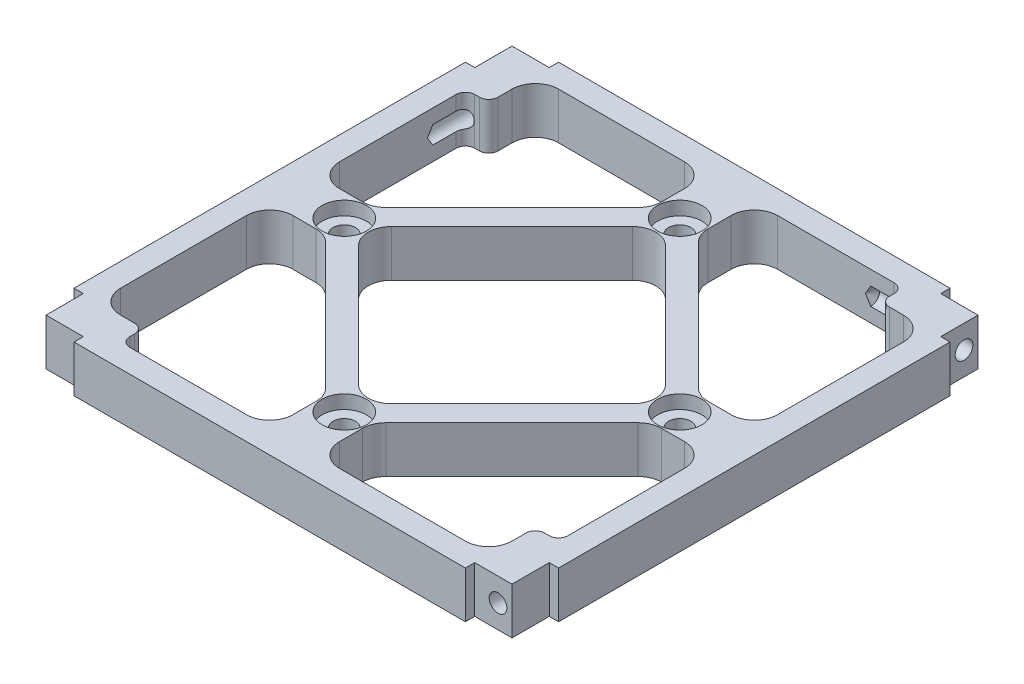
from build123d import *

# Parameters (mm, degrees)
SKETCH1_W                                           = 104
SKETCH1_H                                           = 104
BOSS_EXTRUDE1_DEPTH                                 = 10
FILLET1_R                                           = 5
CUT_EXTRUDE1_DEPTH                                  = 75.215901261
CIRPATTERN1_COUNT                                   = 4
CBORE_FOR_12_BINDING_HEAD_MACHINE_SCREW_D           = 4.8006
CBORE_FOR_12_BINDING_HEAD_MACHINE_SCREW_CBORE_D     = 9.525
CBORE_FOR_12_BINDING_HEAD_MACHINE_SCREW_CBORE_DEPTH = 2.921
FILLET3_R                                           = 2
CIRPATTERN5_COUNT                                   = 4


with BuildPart() as part:
    # Sketch1 → Boss-Extrude1 (new body)
    with BuildSketch(Plane(origin=(0, 0, 0), x_dir=(1, 0, 0), z_dir=(0, 1, 0))):
        Rectangle(SKETCH1_W, SKETCH1_H)
        Polygon((-42, 47), (-42, 37), (-47, 37), (-47, 5), (-35, 5), (-5, 35), (-5, 47), align=None, mode=Mode.SUBTRACT)
        Polygon((-32.928932188, 0), (0, 32.928932188), (32.928932188, 0), (0, -32.928932188), align=None, mode=Mode.SUBTRACT)
        Polygon((5, 47), (5, 35), (35, 5), (47, 5), (47, 42), (37, 42), (37, 47), align=None, mode=Mode.SUBTRACT)
        Polygon((47, -5), (35, -5), (5, -35), (5, -47), (42, -47), (42, -37), (47, -37), align=None, mode=Mode.SUBTRACT)
        Polygon((-5, -47), (-5, -35), (-35, -5), (-47, -5), (-47, -42), (-37, -42), (-37, -47), align=None, mode=Mode.SUBTRACT)
    extrude(amount=BOSS_EXTRUDE1_DEPTH)

    # Fillet1
    fillet1_edges = [part.edges().sort_by_distance(p)[0] for p in [
        (32.928932188, 5, 0),
        (0, 5, 32.928932188),
        (-32.928932188, 5, 0),
        (0, 5, -32.928932188),
        (-5, 5, -47),
        (-5, 5, -35),
        (-35, 5, -5),
        (-47, 5, 42),
        (-47, 5, 5),
        (-35, 5, 5),
        (-5, 5, 35),
        (-5, 5, 47),
        (42, 5, 47),
        (47, 5, 5),
        (35, 5, 5),
        (5, 5, 35),
        (5, 5, 47),
        (47, 5, -42),
        (47, 5, -5),
        (35, 5, -5),
        (5, 5, -35),
        (5, 5, -47),
        (-42, 5, -47),
        (-47, 5, -5),
    ]]
    fillet(fillet1_edges, radius=FILLET1_R)

    # Sketch2 → Cut-Extrude1 (cut, through all)
    with BuildSketch(Plane(origin=(0, 10, 0), x_dir=(1, 0, 0), z_dir=(0, 1, 0))):
        Polygon((-52, 52), (-42, 52), (-42, 50), (-50, 50), (-50, 42), (-52, 42), align=None)
    cut_extrude1 = extrude(amount=-CUT_EXTRUDE1_DEPTH, mode=Mode.SUBTRACT)

    # CirPattern1: Cut-Extrude1 ×4 about axis
    cirpattern1_axis = Axis((0, 10.5, 0), (0, -1, 0))
    for i in range(1, CIRPATTERN1_COUNT):
        add(cut_extrude1.rotate(cirpattern1_axis, i * 360 / CIRPATTERN1_COUNT), mode=Mode.SUBTRACT)

    # CBORE for #12 Binding Head Machine Screw1 (through all)
    with Locations(Plane(origin=(0, 10, 0), x_dir=(1, 0, 0), z_dir=(0, 1, 0))):
        with Locations((0, 36), (-36, 0), (0, -36), (36, 0)):
            CounterBoreHole(CBORE_FOR_12_BINDING_HEAD_MACHINE_SCREW_D / 2, CBORE_FOR_12_BINDING_HEAD_MACHINE_SCREW_CBORE_D / 2, CBORE_FOR_12_BINDING_HEAD_MACHINE_SCREW_CBORE_DEPTH)

    # Fillet3
    fillet3_edges = [part.edges().sort_by_distance(p)[0] for p in [
        (-37, 5, 42),
        (-37, 5, 47),
        (42, 5, 37),
        (47, 5, 37),
        (37, 5, -42),
        (37, 5, -47),
        (-47, 5, -37),
        (-42, 5, -37),
    ]]
    fillet(fillet3_edges, radius=FILLET3_R)

    # Sketch9 → #10-24 Tapped Hole1 (revolve, cut)
    with BuildSketch(Plane(origin=(50, 5, -47), x_dir=(0, 0, -1), z_dir=(0, 1, 0))):
        Polygon((0, 0), (0, 21.140824014), (1.89865, 20), (1.89865, 0), align=None)
    f_10_24_tapped_hole1 = revolve(axis=Axis((56.35, 5, -47), (-1, 0, 0)), mode=Mode.SUBTRACT)

    # CirPattern5: #10-24 Tapped Hole1 ×4 about axis
    cirpattern5_axis = Axis((0, 10.5, 0), (0, -1, 0))
    for i in range(1, CIRPATTERN5_COUNT):
        add(f_10_24_tapped_hole1.rotate(cirpattern5_axis, i * 360 / CIRPATTERN5_COUNT), mode=Mode.SUBTRACT)


solid = part.part
